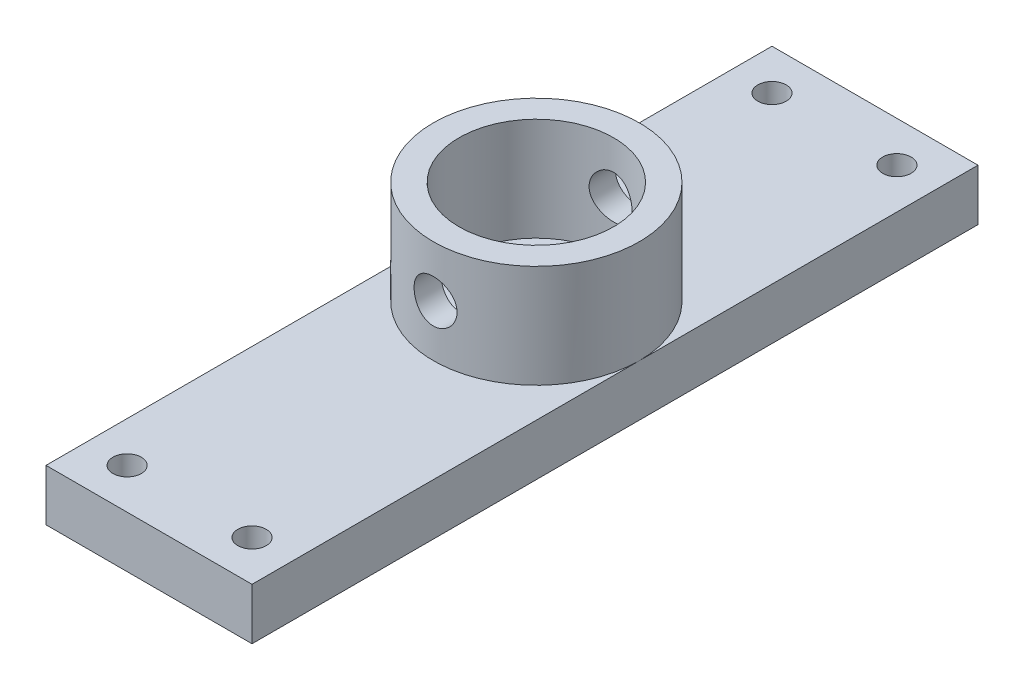
from build123d import *

# Parameters (mm, degrees)
SKETCH1_W           = 25.4
SKETCH1_H           = 89.50000007
SKETCH1_R           = 1.75
BOSS_EXTRUDE1_DEPTH = 6.35
SKETCH2_R           = 12.7
SKETCH2_R_2         = 9.525
BOSS_EXTRUDE2_DEPTH = 12.7
SKETCH4_R           = 2.65
CUT_EXTRUDE2_DEPTH  = 33.02


with BuildPart() as part:
    # Sketch1 → Boss-Extrude1 (new body)
    with BuildSketch(Plane(origin=(0, 0, 0), x_dir=(1, 0, 0), z_dir=(0, 1, 0))):
        with Locations((12.7, 44.750000035)):
            Rectangle(SKETCH1_W, SKETCH1_H)
        with Locations((5, 84.50000007)):
            Circle(SKETCH1_R, mode=Mode.SUBTRACT)
        with Locations((20.4, 84.50000007)):
            Circle(SKETCH1_R, mode=Mode.SUBTRACT)
        with Locations((5, 5)):
            Circle(SKETCH1_R, mode=Mode.SUBTRACT)
        with Locations((20.4, 5)):
            Circle(SKETCH1_R, mode=Mode.SUBTRACT)
    extrude(amount=BOSS_EXTRUDE1_DEPTH)

    # Sketch2 → Boss-Extrude2 (add)
    with BuildSketch(Plane(origin=(0, 6.35, 0), x_dir=(1, 0, 0), z_dir=(0, 1, 0))):
        with Locations((12.7, 47.75000007)):
            Circle(SKETCH2_R)
        with Locations((12.7, 47.75000007)):
            Circle(SKETCH2_R_2, mode=Mode.SUBTRACT)
    extrude(amount=BOSS_EXTRUDE2_DEPTH)

    # Sketch4 → Cut-Extrude2 (cut)
    with BuildSketch(Plane(origin=(0, 0, -35.05000007), x_dir=(0, -1, 0), z_dir=(0, 0, 1))):
        with Locations((-12.7, 12.7)):
            Circle(SKETCH4_R)
    extrude(amount=-CUT_EXTRUDE2_DEPTH, mode=Mode.SUBTRACT)


solid = part.part
